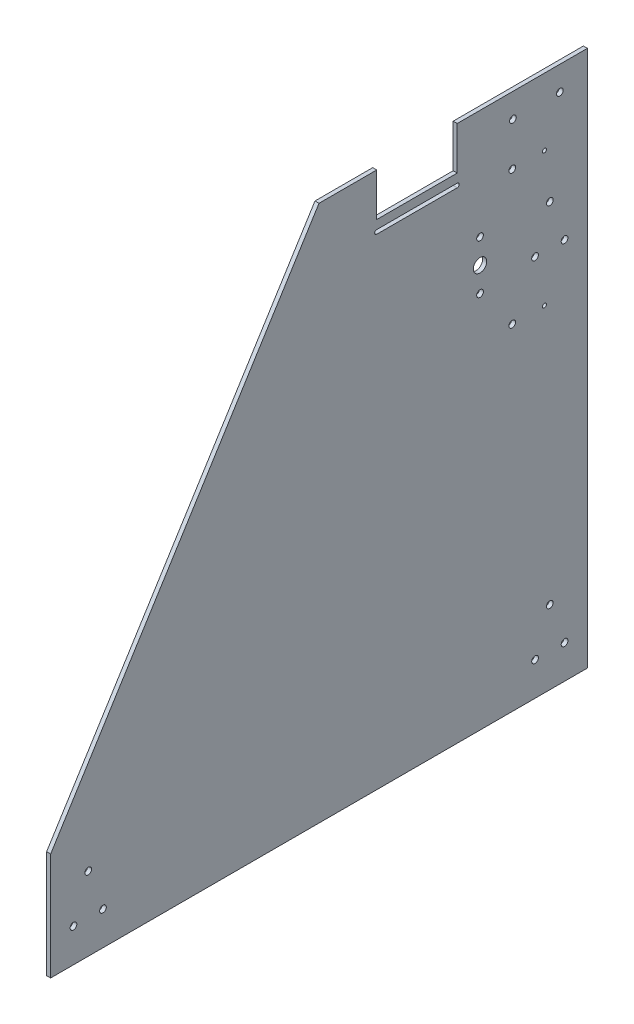
from build123d import *

# Parameters (mm, degrees)
SKETCH1_R                  = 2.5
SKETCH1_R_2                = 5
BOSS_EXTRUDE1_DEPTH        = 5
CONVERT_SOLID1_OUTLINE_R   = 2.5
CONVERT_SOLID1_OUTLINE_R_2 = 5
CONVERT_SOLID1_DEPTH       = 2
SKETCH6_R                  = 2.5
CUT_EXTRUDE1_DEPTH         = 10
SKETCH7_R                  = 2.5
CUT_EXTRUDE2_DEPTH         = 10
SKETCH8_R                  = 2.5
CUT_EXTRUDE3_DEPTH         = 10
SKETCH9_R                  = 1.5
CUT_EXTRUDE4_DEPTH         = 10
SKETCH10_W                 = 60
SKETCH10_H                 = 32
CUT_EXTRUDE5_DEPTH         = 10


# Read off the part's stored shape, not the designer's step: Convert-Solid1
with BuildPart() as part:
    # Sketch1 → Boss-Extrude1 (new body)
    with BuildSketch(Plane(origin=(0, 0, 0), x_dir=(0, 0, -1), z_dir=(1, 0, 0))):
        Polygon((0, 0), (400, 0), (400, 400), (200, 400), (0, 80), align=None)
        with Locations((344, 350)):
            Circle(SKETCH1_R, mode=Mode.SUBTRACT)
        with Locations((344, 250)):
            Circle(SKETCH1_R, mode=Mode.SUBTRACT)
        with Locations((320, 300)):
            Circle(SKETCH1_R_2, mode=Mode.SUBTRACT)
        with Locations((320, 318.25)):
            Circle(SKETCH1_R, mode=Mode.SUBTRACT)
        with Locations(Location((320, 281.75, 0), (0, 0, 180))):
            Circle(SKETCH1_R, mode=Mode.SUBTRACT)
    extrude(amount=BOSS_EXTRUDE1_DEPTH)

    # Convert-Solid1 outline → Convert-Solid1 (cut)
    with BuildSketch(Plane.YZ):
        Polygon((80, 0), (0, 0), (0, -400), (400, -400), (400, -200), align=None)
        with Locations((250, -344)):
            Circle(CONVERT_SOLID1_OUTLINE_R, mode=Mode.SUBTRACT)
        with Locations((281.75, -320)):
            Circle(CONVERT_SOLID1_OUTLINE_R, mode=Mode.SUBTRACT)
        with Locations((300, -320)):
            Circle(CONVERT_SOLID1_OUTLINE_R_2, mode=Mode.SUBTRACT)
        with Locations((350, -344)):
            Circle(CONVERT_SOLID1_OUTLINE_R, mode=Mode.SUBTRACT)
        with Locations((318.25, -320)):
            Circle(CONVERT_SOLID1_OUTLINE_R, mode=Mode.SUBTRACT)
    extrude(amount=CONVERT_SOLID1_DEPTH, mode=Mode.SUBTRACT)

    # Sketch6 → Cut-Extrude1 (cut)
    with BuildSketch(Plane(origin=(5, 0, 0), x_dir=(0, 0, -1), z_dir=(1, 0, 0))):
        with Locations((28, 55)):
            Circle(SKETCH6_R)
        with Locations((39, 25)):
            Circle(SKETCH6_R)
        with Locations(Location((17, 25, 0), (0, 0, 180))):
            Circle(SKETCH6_R)
        with Locations((383, 25)):
            Circle(SKETCH6_R)
        with Locations(Location((361, 25, 0), (0, 0, 180))):
            Circle(SKETCH6_R)
        with Locations(Location((372, 55, 0), (0, 0, 180))):
            Circle(SKETCH6_R)
    extrude(amount=-CUT_EXTRUDE1_DEPTH, mode=Mode.SUBTRACT)

    # Sketch7 → Cut-Extrude2 (cut)
    with BuildSketch(Plane.ZY.offset(-2)):
        with Locations((-372, 315)):
            Circle(SKETCH7_R)
        with Locations((-361, 285)):
            Circle(SKETCH7_R)
        with Locations(Location((-383, 285, 0), (0, 0, 180))):
            Circle(SKETCH7_R)
    extrude(amount=-CUT_EXTRUDE2_DEPTH, mode=Mode.SUBTRACT)

    # Sketch8 → Cut-Extrude3 (cut)
    with BuildSketch(Plane.ZY.offset(-2)):
        with Locations((-344.5, 382)):
            Circle(SKETCH8_R)
        with Locations((-379.5, 382)):
            Circle(SKETCH8_R)
    extrude(amount=-CUT_EXTRUDE3_DEPTH, mode=Mode.SUBTRACT)

    # Sketch9 → Cut-Extrude4 (cut)
    with BuildSketch(Plane.ZY.offset(-2)):
        with Locations((-368, 350)):
            Circle(SKETCH9_R)
        with Locations((-368, 250)):
            Circle(SKETCH9_R)
    extrude(amount=-CUT_EXTRUDE4_DEPTH, mode=Mode.SUBTRACT)

    # Sketch10 → Cut-Extrude5 (cut)
    with BuildSketch(Plane(origin=(5, 0, 0), x_dir=(0, 0, -1), z_dir=(1, 0, 0))):
        with Locations((273, 384)):
            Rectangle(SKETCH10_W, SKETCH10_H)
        with BuildLine():
            Line((243, 361.5), (303, 361.5))
            ThreePointArc((303, 361.5), (304.5, 360), (303, 358.5))
            Line((303, 358.5), (243, 358.5))
            ThreePointArc((243, 358.5), (241.5, 360), (243, 361.5))
        make_face()
    extrude(amount=-CUT_EXTRUDE5_DEPTH, mode=Mode.SUBTRACT)


solid = part.part
